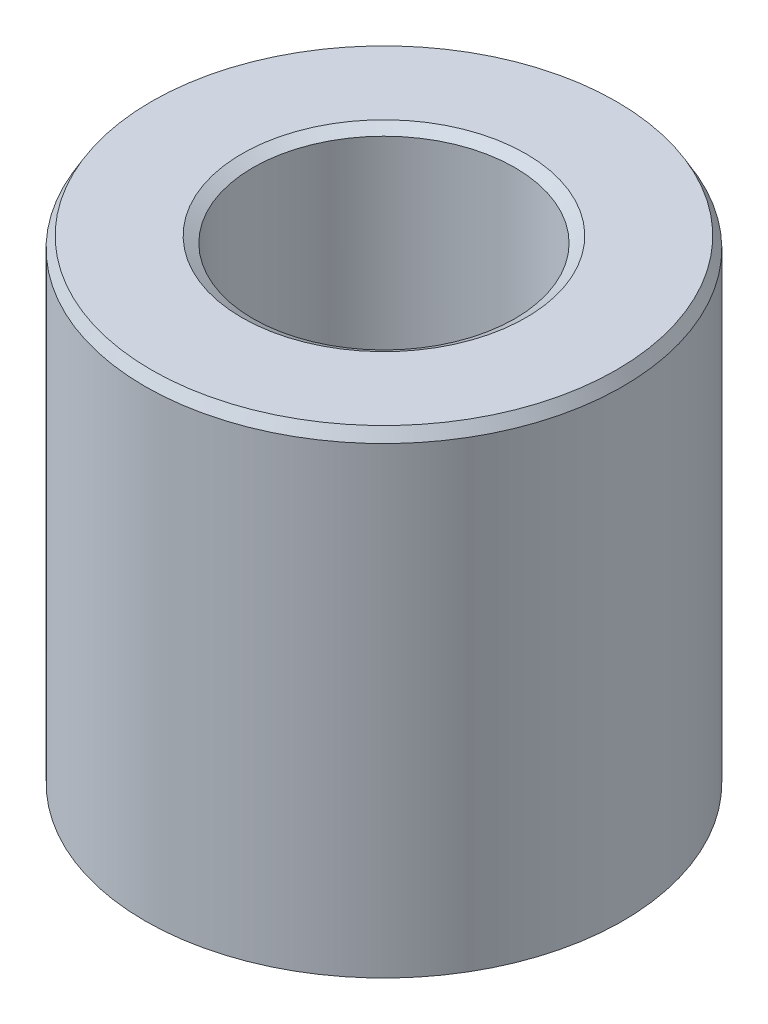
from build123d import *
from OCP.BRepFilletAPI import BRepFilletAPI_MakeChamfer

# Parameters (mm, degrees)
SKETCH1_R           = 30
BOSS_EXTRUDE1_DEPTH = 60.317457829
SKETCH2_R           = 16.440388887
CUT_EXTRUDE1_DEPTH  = 74.744123284
CHAMFER1_SIZE       = 1.391511551
CHAMFER1_SIZE2      = 0.803389569


with BuildPart() as part:
    # Sketch1 → Boss-Extrude1 (new body)
    with BuildSketch(Plane(origin=(0, 0, 0), x_dir=(1, 0, 0), z_dir=(0, 1, 0))):
        Circle(SKETCH1_R)
    extrude(amount=BOSS_EXTRUDE1_DEPTH)

    # Sketch2 → Cut-Extrude1 (cut, through all)
    with BuildSketch(Plane(origin=(0, 0, 0), x_dir=(1, 0, 0), z_dir=(0, 1, 0))):
        Circle(SKETCH2_R)
    extrude(amount=CUT_EXTRUDE1_DEPTH, mode=Mode.SUBTRACT)

    # Chamfer1: one chamfer whose edges measure the first distance from different faces: ONE call of the kernel's chamfer builder (chamfer() names one face for all edges)
    chamfer1_edges_1 = [part.edges().sort_by_distance(p)[0] for p in [
        (-16.440388887, 60.317457829, 0),
    ]]
    chamfer1_side_1 = [part.faces().sort_by_distance(p)[0] for p in [
        (-29.151471863, 60.317457829, 0),
    ]]
    chamfer1_edges_2 = [part.edges().sort_by_distance(p)[0] for p in [
        (-16.440388887, 0, 0),
    ]]
    chamfer1_side_2 = [part.faces().sort_by_distance(p)[0] for p in [
        (-16.440388887, 30.158728915, 0),
    ]]
    chamfer1_edges_3 = [part.edges().sort_by_distance(p)[0] for p in [
        (-30, 0, 0),
    ]]
    chamfer1_side_3 = [part.faces().sort_by_distance(p)[0] for p in [
        (-29.151471863, 0, 0),
    ]]
    chamfer1_edges_4 = [part.edges().sort_by_distance(p)[0] for p in [
        (-30, 60.317457829, 0),
    ]]
    chamfer1_side_4 = [part.faces().sort_by_distance(p)[0] for p in [
        (-30, 30.158728915, 0),
    ]]
    chamfer1 = BRepFilletAPI_MakeChamfer(part.part.solid().wrapped)
    for e in chamfer1_edges_1:
        chamfer1.Add(CHAMFER1_SIZE, CHAMFER1_SIZE2, e.wrapped, chamfer1_side_1[0].wrapped)  # the first distance lies on this face
    for e in chamfer1_edges_2:
        chamfer1.Add(CHAMFER1_SIZE, CHAMFER1_SIZE2, e.wrapped, chamfer1_side_2[0].wrapped)  # the first distance lies on this face
    for e in chamfer1_edges_3:
        chamfer1.Add(CHAMFER1_SIZE, CHAMFER1_SIZE2, e.wrapped, chamfer1_side_3[0].wrapped)  # the first distance lies on this face
    for e in chamfer1_edges_4:
        chamfer1.Add(CHAMFER1_SIZE, CHAMFER1_SIZE2, e.wrapped, chamfer1_side_4[0].wrapped)  # the first distance lies on this face
    add(Compound.cast(chamfer1.Shape()), mode=Mode.REPLACE)


solid = part.part
